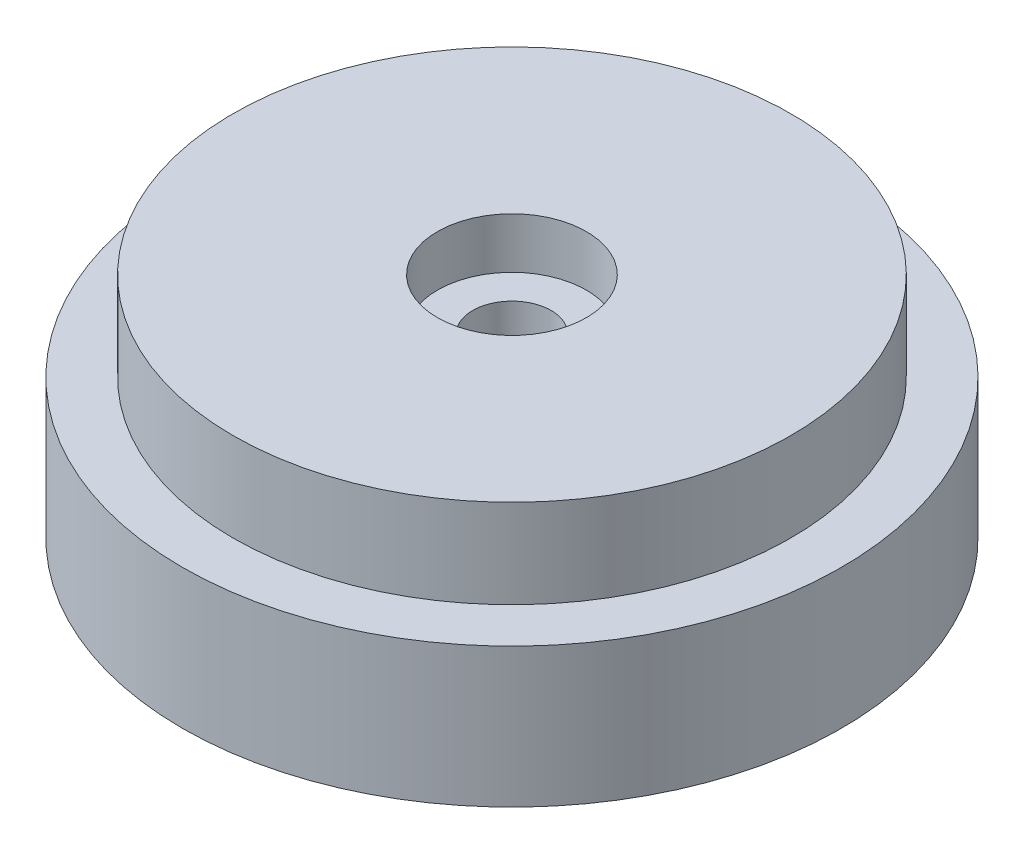
from build123d import *

# Parameters (mm, degrees)
SKETCH2_R           = 11
SKETCH2_R_2         = 2.94
BOSS_EXTRUDE1_DEPTH = 9
SKETCH2_3_R         = 2.94
SKETCH2_3_R_2       = 1.55
BOSS_EXTRUDE2_DEPTH = 7
SKETCH2_4_R         = 2.94
SKETCH2_4_R_2       = 1.55
CUT_EXTRUDE1_DEPTH  = 3
SKETCH2_6_R         = 3.05
CUT_EXTRUDE2_DEPTH  = 8.6
SKETCH2_7_R         = 13
SKETCH2_7_R_2       = 11
BOSS_EXTRUDE3_DEPTH = 5.5


with BuildPart() as part:
    # Sketch2 → Boss-Extrude1 (new body)
    with BuildSketch(Plane(origin=(0, 0, 0), x_dir=(1, 0, 0), z_dir=(0, 1, 0))):
        Circle(SKETCH2_R)
        Circle(SKETCH2_R_2, mode=Mode.SUBTRACT)
    extrude(amount=BOSS_EXTRUDE1_DEPTH)

    # Sketch2<3> → Boss-Extrude2 (add)
    with BuildSketch(Plane(origin=(0, 0, 0), x_dir=(1, 0, 0), z_dir=(0, 1, 0))):
        Circle(SKETCH2_3_R)
        Circle(SKETCH2_3_R_2, mode=Mode.SUBTRACT)
    extrude(amount=BOSS_EXTRUDE2_DEPTH)

    # Sketch2<4> → Cut-Extrude1 (cut)
    with BuildSketch(Plane(origin=(0, 0, 0), x_dir=(1, 0, 0), z_dir=(0, 1, 0))):
        Circle(SKETCH2_4_R)
        Circle(SKETCH2_4_R_2, mode=Mode.SUBTRACT)
    extrude(amount=CUT_EXTRUDE1_DEPTH, mode=Mode.SUBTRACT)

    # Sketch2<6> → Cut-Extrude2 (cut)
    with BuildSketch(Plane(origin=(0, 0, 0), x_dir=(1, 0, 0), z_dir=(0, 1, 0))):
        with Locations((-5, 5)):
            Circle(SKETCH2_6_R)
        with Locations((5, 5)):
            Circle(SKETCH2_6_R)
        with Locations((5, -5)):
            Circle(SKETCH2_6_R)
        with Locations((-5, -5)):
            Circle(SKETCH2_6_R)
    extrude(amount=CUT_EXTRUDE2_DEPTH, mode=Mode.SUBTRACT)

    # Sketch2<7> → Boss-Extrude3 (add)
    with BuildSketch(Plane(origin=(0, 0, 0), x_dir=(1, 0, 0), z_dir=(0, 1, 0))):
        Circle(SKETCH2_7_R)
        Circle(SKETCH2_7_R_2, mode=Mode.SUBTRACT)
    extrude(amount=BOSS_EXTRUDE3_DEPTH)


solid = part.part
